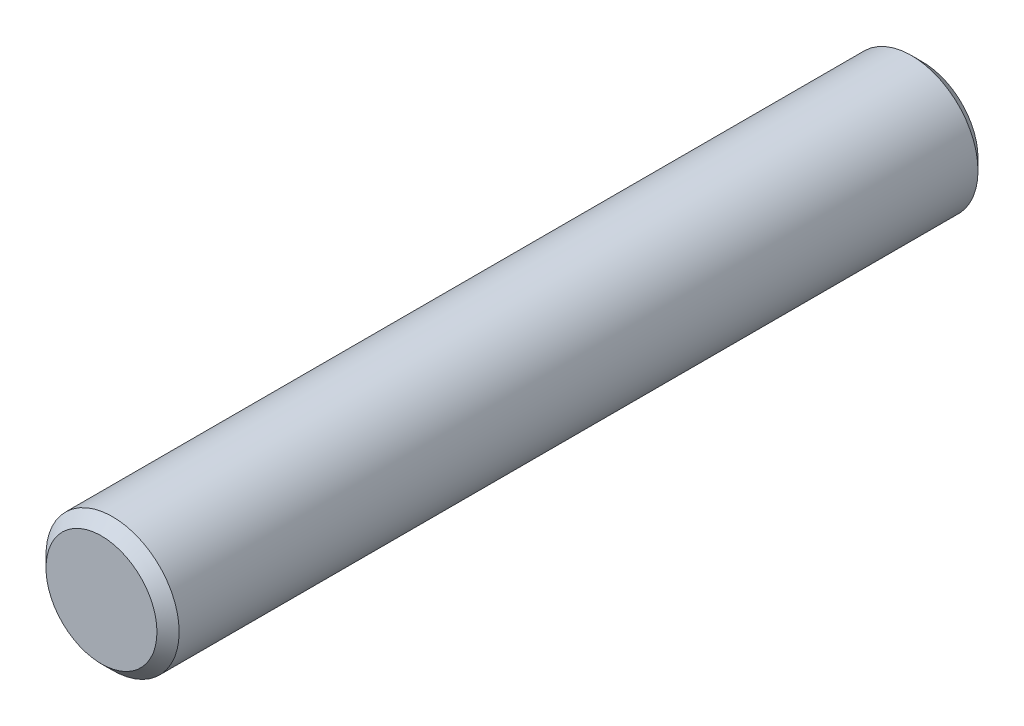
from build123d import *

# Parameters (mm, degrees)
SKETCH1_R           = 3
BOSS_EXTRUDE1_DEPTH = 37
CHAMFER1_SIZE       = 0.5


with BuildPart() as part:
    # Sketch1 → Boss-Extrude1 (new body)
    with BuildSketch(Plane.XY):
        Circle(SKETCH1_R)
    extrude(amount=BOSS_EXTRUDE1_DEPTH)

    # Chamfer1
    chamfer1_edges = [part.edges().sort_by_distance(p)[0] for p in [
        (-3, 0, 0),
        (-3, 0, 37),
    ]]
    chamfer(chamfer1_edges, length=CHAMFER1_SIZE)


solid = part.part
